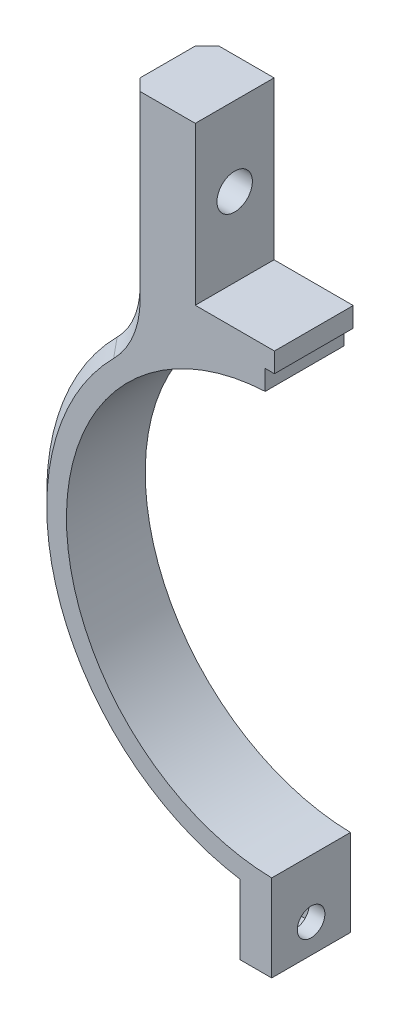
from build123d import *

# Parameters (mm, degrees)
AUFSATZ_LINEAR_AUSTRAGEN1_DEPTH = 10
SKIZZE2_R                       = 1.75
SCHNITT_LINEAR_AUSTRAGEN1_DEPTH = 64.134024107
SKIZZE4_R                       = 2.25
SCHNITT_LINEAR_AUSTRAGEN3_DEPTH = 72.992812141
VERRUNDUNG1_R                   = 10
SKIZZE5_W                       = 5.55
SKIZZE5_H                       = 5.55
SCHNITT_LINEAR_AUSTRAGEN4_DEPTH = 2
SCHNITT_LINEAR_AUSTRAGEN5_DEPTH = 61.751172828
FASE1_SIZE                      = 1.5
SCHNITT_LINEAR_AUSTRAGEN6_DEPTH = 61.751172828


with BuildPart() as part:
    # Skizze1 → Aufsatz-Linear austragen1 (new body)
    with BuildSketch(Plane.XY):
        with BuildLine():
            Line((0.5, -26.545291485), (0.5, -30.545908073))
            Line((0.5, -30.545908073), (0.5, -37.545908073))
            Line((0.5, -37.545908073), (4.5, -37.545908073))
            Line((4.5, -37.545908073), (4.5, -30.216758595))
            ThreePointArc((4.5, -30.216758595), (29.558680329, -7.719256261), (18.7, 24.158073185))
            Line((18.7, 24.158073185), (18.7, 51.55))
            Line((18.7, 51.55), (10.2, 51.55))
            Line((10.2, 51.55), (10.2, 31.55))
            Line((10.2, 31.55), (-10.2, 31.55))
            Line((-10.2, 31.55), (-10.2, 51.55))
            Line((-10.2, 51.55), (-18.7, 51.55))
            Line((-18.7, 51.55), (-18.7, 24.158073185))
            ThreePointArc((-18.7, 24.158073185), (-29.558680329, -7.719256261), (-4.5, -30.216758595))
            Line((-4.5, -30.216758595), (-4.5, -37.545908073))
            Line((-4.5, -37.545908073), (-0.5, -37.545908073))
            Line((-0.5, -37.545908073), (-0.5, -30.545908073))
            Line((-0.5, -30.545908073), (-0.5, -26.545291485))
            ThreePointArc((-0.5, -26.545291485), (0, 26.55), (0.5, -26.545291485))
        make_face()
    extrude(amount=AUFSATZ_LINEAR_AUSTRAGEN1_DEPTH)

    # Skizze2 → Schnitt-Linear austragen1 (cut, through all)
    with BuildSketch(Plane.ZY.offset(4.5)):
        with Locations((5, -33.881333334)):
            Circle(SKIZZE2_R)
    extrude(amount=-SCHNITT_LINEAR_AUSTRAGEN1_DEPTH, mode=Mode.SUBTRACT)

    # Skizze4 → Schnitt-Linear austragen3 (cut, through all)
    with BuildSketch(Plane.ZY.offset(18.7)):
        with Locations((5, 41.55)):
            Circle(SKIZZE4_R)
    extrude(amount=-SCHNITT_LINEAR_AUSTRAGEN3_DEPTH, mode=Mode.SUBTRACT)

    # Verrundung1
    verrundung1_edges = [part.edges().sort_by_distance(p)[0] for p in [
        (18.7, 24.158073185, 5),
        (-18.7, 24.158073185, 5),
    ]]
    fillet(verrundung1_edges, radius=VERRUNDUNG1_R)

    # Skizze5 → Schnitt-Linear austragen4 (cut)
    with BuildSketch(Plane.ZY.offset(4.5)):
        with Locations((5, -33.881333334)):
            Rectangle(SKIZZE5_W, SKIZZE5_H)
    extrude(amount=-SCHNITT_LINEAR_AUSTRAGEN4_DEPTH, mode=Mode.SUBTRACT)

    # Skizze6 → Schnitt-Linear austragen5 (cut, through all)
    with BuildSketch(Plane.XY):
        Polygon((0, 0), (0, 63.91348789), (40.013946788, 63.91348789), (48.360414216, -54.819102682), (0, -54.819102682), align=None)
    extrude(amount=SCHNITT_LINEAR_AUSTRAGEN5_DEPTH, mode=Mode.SUBTRACT)

    # Fase1
    fase1_edges = [part.edges().sort_by_distance(p)[0] for p in [
        (-18.7, 40.098167422, 0),
        (-19.459415096, 24.823823807, 0),
        (-29.006358008, -9.588206043, 0),
        (-18.7, 40.098167422, 10),
        (-19.459415096, 24.823823807, 10),
        (-29.006358008, -9.588206043, 10),
    ]]
    chamfer(fase1_edges, length=FASE1_SIZE)

    # Skizze7 → Schnitt-Linear austragen6 (cut, through all)
    with BuildSketch(Plane.XY.offset(10)):
        Polygon((1.325, 29.05), (0, 29.05), (0, 31.55), (-0.15, 31.55), (-0.15, 29.05), (-1.325, 29.05), (-1.325, 23.522445011), (1.325, 23.522445011), align=None)
    extrude(amount=-SCHNITT_LINEAR_AUSTRAGEN6_DEPTH, mode=Mode.SUBTRACT)


solid = part.part
